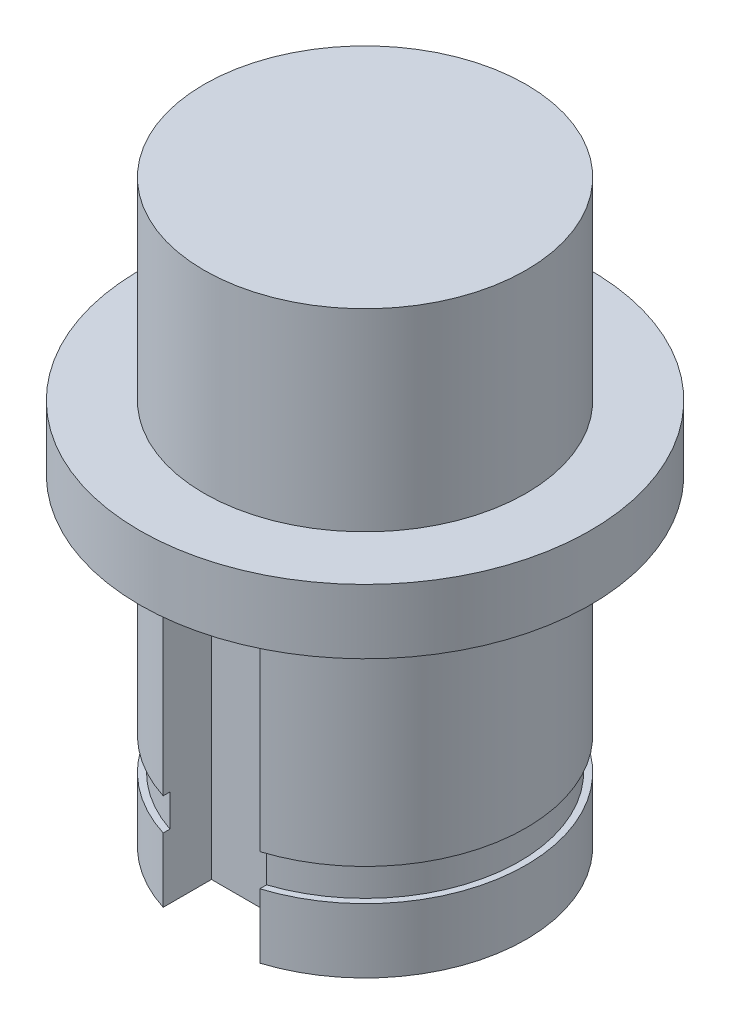
from build123d import *

# Parameters (mm, degrees)
SKETCH1_R               = 5
BOSS_EXTRUDE1_DEPTH     = 18
SKETCH2_W               = 2
SKETCH2_H               = 2
SKETCH2_5_W             = 0.2
SKETCH2_5_H             = 1
CUT_EXTRUDE1_DEPTH      = 21.542638584
CUT_EXTRUDE1_DEPTH_BACK = 10
CUT_EXTRUDE2_DEPTH      = 16


with BuildPart() as part:
    # Sketch1 → Boss-Extrude1 (new body)
    with BuildSketch(Plane(origin=(0, 0, 0), x_dir=(1, 0, 0), z_dir=(0, 1, 0))):
        Circle(SKETCH1_R)
    extrude(amount=BOSS_EXTRUDE1_DEPTH)

    # Sketch2 → Revolve1 (revolve)
    with BuildSketch(Plane(origin=(0, 0, 0), x_dir=(0, 0, -1), z_dir=(1, 0, 0))):
        with Locations((6, 11)):
            Rectangle(SKETCH2_W, SKETCH2_H)
    revolve(axis=Axis((0, 18, 0), (0, -1, 0)))

    # Sketch2<5> → Cut-Revolve1 (revolve, cut)
    with BuildSketch(Plane(origin=(0, 0, 0), x_dir=(0, 0, -1), z_dir=(1, 0, 0))):
        with Locations((4.9, 2.5)):
            Rectangle(SKETCH2_5_W, SKETCH2_5_H)
    revolve(axis=Axis((0, 18, 0), (0, -1, 0)), mode=Mode.SUBTRACT)

    # Sketch4 → Cut-Extrude1 (cut, two sides: drawn at the far end of the back side and taken through both)
    with BuildSketch(Plane.XZ.offset(-CUT_EXTRUDE1_DEPTH_BACK)):
        Polygon((-1.5, 43.805931583), (-1.5, 4.769696007), (-1.5, 3.269696007), (1.5, 3.269696007), (1.5, 4.769696007), (1.5, 43.805931583), (1.5, 121.878402734), (-1.5, 121.878402734), align=None)
    extrude(amount=CUT_EXTRUDE1_DEPTH + CUT_EXTRUDE1_DEPTH_BACK, mode=Mode.SUBTRACT)

    # Sketch5 → Cut-Extrude2 (cut)
    with BuildSketch(Plane.XZ):
        with BuildLine():
            Line((1.5, 2), (-1.5, 2))
            ThreePointArc((-1.5, 2), (0, -2.5), (1.5, 2))
        make_face()
    extrude(amount=-CUT_EXTRUDE2_DEPTH, mode=Mode.SUBTRACT)


solid = part.part
